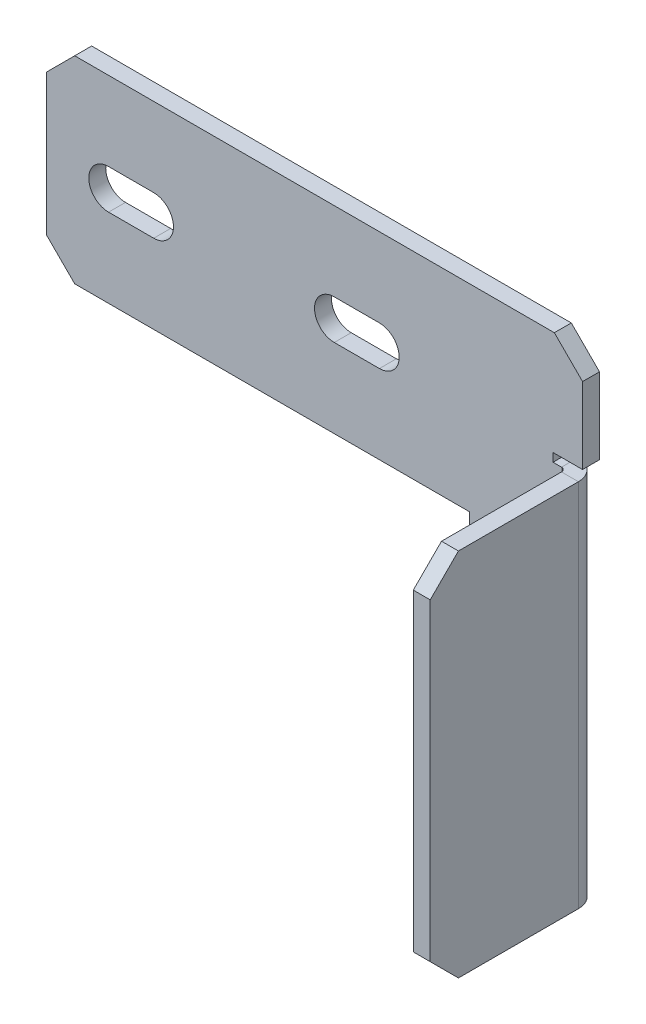
from build123d import *

# Parameters (mm, degrees)
SM_BASE_FLANGE_1_DEPTH            = 3
SM_EDGE_FLANGE_1_STRIP_W          = 13.4732
SM_EDGE_FLANGE_1_STRIP_H          = 3
SM_EDGE_FLANGE_1_STRIP_CUT_DEPTH  = 65.533094289
SM_EDGE_FLANGE_1_RELIEF_W         = 14.9732
SM_EDGE_FLANGE_1_RELIEF_H         = 1.5
SM_EDGE_FLANGE_1_RELIEF_CUT_DEPTH = 3
SM_EDGE_FLANGE_1_DEPTH            = 65.533094289
CHAMFER_1_SIZE                    = 5
CUT_EXTRUDE_1_DEPTH               = 10


# Sheet-metal steps are written as plain solids
with BuildPart() as part:
    # Sketch 1 → 基体-法兰1 (new body)
    with BuildSketch(Plane.XY):
        Polygon((75, -35), (75, -85.533094289), (95, -85.533094289), (95, 0), (0, 0), (0, -35), align=None)
    extrude(amount=-SM_BASE_FLANGE_1_DEPTH)

    # 边线-法兰1 strip (across the edge) → 边线-法兰1 strip cut (cut)
    with BuildSketch(Plane(origin=(95, -85.533094289, 0), x_dir=(-1, 0, 0), z_dir=(0, 1, 0))):
        with Locations((-3, -1.5)):
            Rectangle(SM_EDGE_FLANGE_1_STRIP_W, SM_EDGE_FLANGE_1_STRIP_H)
    extrude(amount=SM_EDGE_FLANGE_1_STRIP_CUT_DEPTH, mode=Mode.SUBTRACT)

    # 边线-法兰1 relief (on the sheet) → 边线-法兰1 relief cut (cut)
    with BuildSketch(Plane(origin=(91.2634, -85.533094289, 0), x_dir=(-1, 0, 0), z_dir=(0, 0, 1))):
        with Locations((-5.9866, -66.283094289)):
            Rectangle(SM_EDGE_FLANGE_1_RELIEF_W, SM_EDGE_FLANGE_1_RELIEF_H)
    extrude(amount=-SM_EDGE_FLANGE_1_RELIEF_CUT_DEPTH, mode=Mode.SUBTRACT)

    # 边线-法兰1 section (across the edge) → 边线-法兰1 (add)
    with BuildSketch(Plane(origin=(95, -85.533094289, 0), x_dir=(-1, 0, 0), z_dir=(0, 1, 0))):
        with BuildLine():
            Line((0, 0.7366), (0, 27))
            Line((0, 27), (3, 27))
            Line((3, 27), (3, 0.7366))
            ThreePointArc((3, 0.7366), (3.215745145, 0.215745145), (3.7366, 0))
            Line((3.7366, 0), (3.7366, -3))
            ThreePointArc((3.7366, -3), (1.094424801, -1.905575199), (0, 0.7366))
        make_face()
    extrude(amount=SM_EDGE_FLANGE_1_DEPTH)

    # 倒角1
    chamfer_1_edges = [part.edges().sort_by_distance(p)[0] for p in [
        (0, 0, -1.5),
        (95, 0, -1.5),
        (75, -85.533094289, -1.5),
        (0, -35, -1.5),
        (93.5, -85.533094289, 27),
        (93.5, -20, 27),
    ]]
    chamfer(chamfer_1_edges, length=CHAMFER_1_SIZE)

    # 草图10 → 切除-拉伸1 (cut)
    with BuildSketch(Plane.XY):
        with BuildLine():
            Line((11, -14), (19, -14))
            ThreePointArc((19, -14), (22.5, -17.5), (19, -21))
            Line((19, -21), (11, -21))
            ThreePointArc((11, -21), (7.5, -17.5), (11, -14))
        make_face()
        with BuildLine():
            Line((51, -14), (59, -14))
            ThreePointArc((59, -14), (62.5, -17.5), (59, -21))
            Line((59, -21), (51, -21))
            ThreePointArc((51, -21), (47.5, -17.5), (51, -14))
        make_face()
    extrude(amount=-CUT_EXTRUDE_1_DEPTH, mode=Mode.SUBTRACT)


solid = part.part
